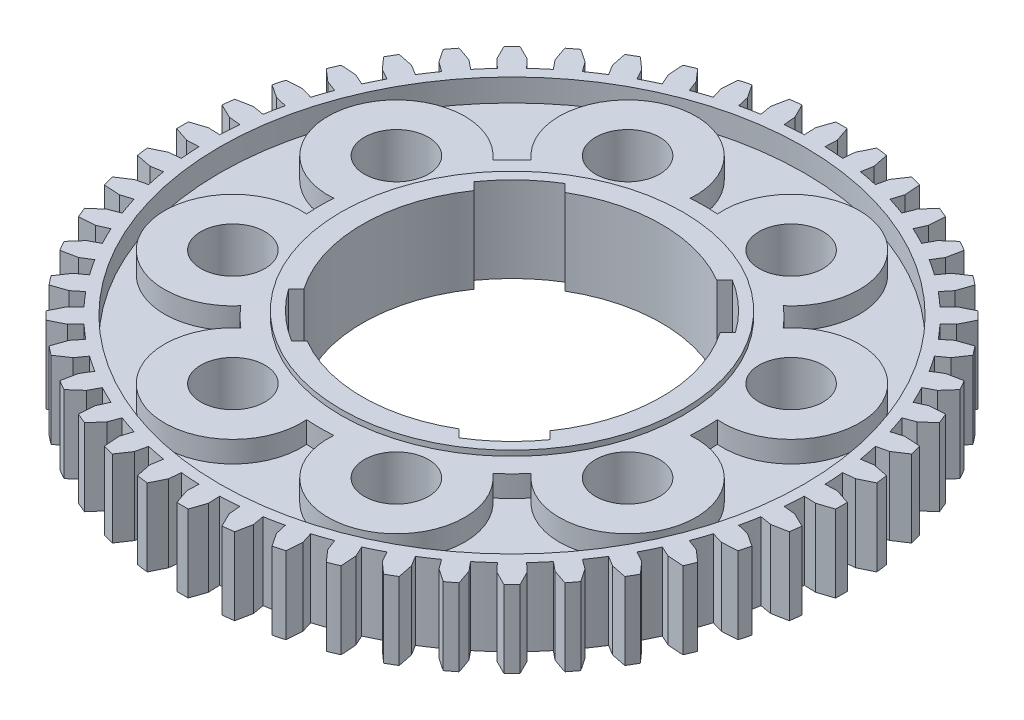
from build123d import *

# Parameters (mm, degrees)
BOSS_EXTRU_1_DEPTH      = 4
BOSS_EXTRU_1_DEPTH_BACK = 4
ESQUISSE2_R             = 16
BOSS_EXTRU_2_DEPTH      = 3.5
BOSS_EXTRU_2_DEPTH_BACK = 3.5
ESQUISSE2_6_R           = 3
ESQUISSE2_6_R_2         = 16
BOSS_EXTRU_3_DEPTH      = 1.5
BOSS_EXTRU_3_DEPTH_BACK = 1.5
ESQUISSE2_7_R           = 27.35
BOSS_EXTRU_4_DEPTH      = 3.61
BOSS_EXTRU_4_DEPTH_BACK = 3.61
ESQUISSE2_8_R           = 27.35


with BuildPart() as part:
    # Esquisse2 → Boss.-Extru.1 (new, two sides: drawn at the far end of the back side and taken through both)
    with BuildSketch(Plane(origin=(0, 0, 0), x_dir=(1, 0, 0), z_dir=(0, 1, 0)).offset(-BOSS_EXTRU_1_DEPTH_BACK)):
        Circle(ESQUISSE2_R)
        with BuildLine():
            ThreePointArc((-12.226017285, 8.690483379), (-10.241104329, 10.959917068), (-7.842441258, 12.786559941))
            Line((-7.842441258, 12.786559941), (-7.113811647, 12.05793033))
            ThreePointArc((-7.113811647, 12.05793033), (0, 14), (7.113811647, 12.05793033))
            Line((7.113811647, 12.05793033), (7.842441258, 12.786559941))
            ThreePointArc((7.842441258, 12.786559941), (10.241104329, 10.959917068), (12.226017285, 8.690483379))
            Line((12.226017285, 8.690483379), (11.508146822, 7.972612916))
            ThreePointArc((11.508146822, 7.972612916), (14, 0), (11.508146822, -7.972612916))
            Line((11.508146822, -7.972612916), (12.226017285, -8.690483379))
            ThreePointArc((12.226017285, -8.690483379), (10.241104329, -10.959917068), (7.842441258, -12.786559941))
            Line((7.842441258, -12.786559941), (7.113811647, -12.05793033))
            ThreePointArc((7.113811647, -12.05793033), (0, -14), (-7.113811647, -12.05793033))
            Line((-7.113811647, -12.05793033), (-7.842441258, -12.786559941))
            ThreePointArc((-7.842441258, -12.786559941), (-10.241104329, -10.959917068), (-12.226017285, -8.690483379))
            Line((-12.226017285, -8.690483379), (-11.508146822, -7.972612916))
            ThreePointArc((-11.508146822, -7.972612916), (-14, 0), (-11.508146822, 7.972612916))
            Line((-11.508146822, 7.972612916), (-12.226017285, 8.690483379))
        make_face(mode=Mode.SUBTRACT)
    extrude(amount=BOSS_EXTRU_1_DEPTH + BOSS_EXTRU_1_DEPTH_BACK)

    # Esquisse2<6> → Boss.-Extru.2 (add, two sides: drawn at the far end of the back side and taken through both)
    with BuildSketch(Plane(origin=(0, 0, 0), x_dir=(1, 0, 0), z_dir=(0, 1, 0)).offset(-BOSS_EXTRU_2_DEPTH_BACK)):
        with BuildLine():
            ThreePointArc((-13.597550957, 11.794346441), (-24.390419658, 10.102842614), (-17.954782837, 1.275058141))
            ThreePointArc((-17.954782837, 1.275058141), (-18, 0), (-17.954782837, -1.275058141))
            ThreePointArc((-17.954782837, -1.275058141), (-24.390419658, -10.102842614), (-13.597550957, -11.794346441))
            ThreePointArc((-13.597550957, -11.794346441), (-12.727922061, -12.727922061), (-11.794346441, -13.597550957))
            ThreePointArc((-11.794346441, -13.597550957), (-10.102842614, -24.390419658), (-1.275058141, -17.954782837))
            ThreePointArc((-1.275058141, -17.954782837), (0, -18), (1.275058141, -17.954782837))
            ThreePointArc((1.275058141, -17.954782837), (10.102842614, -24.390419658), (11.794346441, -13.597550957))
            ThreePointArc((11.794346441, -13.597550957), (12.727922061, -12.727922061), (13.597550957, -11.794346441))
            ThreePointArc((13.597550957, -11.794346441), (24.390419658, -10.102842614), (17.954782837, -1.275058141))
            ThreePointArc((17.954782837, -1.275058141), (18, 0), (17.954782837, 1.275058141))
            ThreePointArc((17.954782837, 1.275058141), (24.390419658, 10.102842614), (13.597550957, 11.794346441))
            ThreePointArc((13.597550957, 11.794346441), (12.727922061, 12.727922061), (11.794346441, 13.597550957))
            ThreePointArc((11.794346441, 13.597550957), (10.102842614, 24.390419658), (1.275058141, 17.954782837))
            ThreePointArc((1.275058141, 17.954782837), (0, 18), (-1.275058141, 17.954782837))
            ThreePointArc((-1.275058141, 17.954782837), (-10.102842614, 24.390419658), (-11.794346441, 13.597550957))
            ThreePointArc((-11.794346441, 13.597550957), (-12.727922061, 12.727922061), (-13.597550957, 11.794346441))
        make_face()
        with Locations((-7.653668647, -18.47759065)):
            Circle(ESQUISSE2_6_R, mode=Mode.SUBTRACT)
        with Locations((-18.47759065, -7.653668647)):
            Circle(ESQUISSE2_6_R, mode=Mode.SUBTRACT)
        with Locations((7.653668647, -18.47759065)):
            Circle(ESQUISSE2_6_R, mode=Mode.SUBTRACT)
        with Locations((18.47759065, -7.653668647)):
            Circle(ESQUISSE2_6_R, mode=Mode.SUBTRACT)
        with Locations((-18.47759065, 7.653668647)):
            Circle(ESQUISSE2_6_R, mode=Mode.SUBTRACT)
        with Locations((-7.653668647, 18.47759065)):
            Circle(ESQUISSE2_6_R, mode=Mode.SUBTRACT)
        Circle(ESQUISSE2_6_R_2, mode=Mode.SUBTRACT)
        with Locations((18.47759065, 7.653668647)):
            Circle(ESQUISSE2_6_R, mode=Mode.SUBTRACT)
        with Locations((7.653668647, 18.47759065)):
            Circle(ESQUISSE2_6_R, mode=Mode.SUBTRACT)
    extrude(amount=BOSS_EXTRU_2_DEPTH + BOSS_EXTRU_2_DEPTH_BACK)

    # Esquisse2<7> → Boss.-Extru.3 (add, two sides: drawn at the far end of the back side and taken through both)
    with BuildSketch(Plane(origin=(0, 0, 0), x_dir=(1, 0, 0), z_dir=(0, 1, 0)).offset(-BOSS_EXTRU_3_DEPTH_BACK)):
        Circle(ESQUISSE2_7_R)
        with BuildLine():
            ThreePointArc((-17.954782837, -1.275058141), (-18, 0), (-17.954782837, 1.275058141))
            ThreePointArc((-17.954782837, 1.275058141), (-24.390419658, 10.102842614), (-13.597550957, 11.794346441))
            ThreePointArc((-13.597550957, 11.794346441), (-12.727922061, 12.727922061), (-11.794346441, 13.597550957))
            ThreePointArc((-11.794346441, 13.597550957), (-10.102842614, 24.390419658), (-1.275058141, 17.954782837))
            ThreePointArc((-1.275058141, 17.954782837), (0, 18), (1.275058141, 17.954782837))
            ThreePointArc((1.275058141, 17.954782837), (10.102842614, 24.390419658), (11.794346441, 13.597550957))
            ThreePointArc((11.794346441, 13.597550957), (12.727922061, 12.727922061), (13.597550957, 11.794346441))
            ThreePointArc((13.597550957, 11.794346441), (24.390419658, 10.102842614), (17.954782837, 1.275058141))
            ThreePointArc((17.954782837, 1.275058141), (18, 0), (17.954782837, -1.275058141))
            ThreePointArc((17.954782837, -1.275058141), (24.390419658, -10.102842614), (13.597550957, -11.794346441))
            ThreePointArc((13.597550957, -11.794346441), (12.727922061, -12.727922061), (11.794346441, -13.597550957))
            ThreePointArc((11.794346441, -13.597550957), (10.102842614, -24.390419658), (1.275058141, -17.954782837))
            ThreePointArc((1.275058141, -17.954782837), (0, -18), (-1.275058141, -17.954782837))
            ThreePointArc((-1.275058141, -17.954782837), (-10.102842614, -24.390419658), (-11.794346441, -13.597550957))
            ThreePointArc((-11.794346441, -13.597550957), (-12.727922061, -12.727922061), (-13.597550957, -11.794346441))
            ThreePointArc((-13.597550957, -11.794346441), (-24.390419658, -10.102842614), (-17.954782837, -1.275058141))
        make_face(mode=Mode.SUBTRACT)
    extrude(amount=BOSS_EXTRU_3_DEPTH + BOSS_EXTRU_3_DEPTH_BACK)

    # Esquisse2<8> → Boss.-Extru.4 (add, two sides: drawn at the far end of the back side and taken through both)
    with BuildSketch(Plane(origin=(0, 0, 0), x_dir=(1, 0, 0), z_dir=(0, 1, 0)).offset(-BOSS_EXTRU_4_DEPTH_BACK)):
        with BuildLine():
            Line((-4.553787567, 30.511954315), (-4.847033615, 29.054834956))
            Line((-4.847033615, 29.054834956), (-4.658006431, 27.964718416))
            ThreePointArc((-4.658006431, 27.964718416), (-5.530810629, 27.805262699), (-6.398197624, 27.618572866))
            Line((-6.398197624, 27.618572866), (-6.640728818, 28.698046797))
            Line((-6.640728818, 28.698046797), (-7.469268277, 29.932029145))
            ThreePointArc((-7.469268277, 29.932029145), (-7.98454169, 29.798715263), (-8.497438497, 29.656531764))
            Line((-8.497438497, 29.656531764), (-8.597983543, 28.173601974))
            Line((-8.597983543, 28.173601974), (-8.268284752, 27.117484531))
            ThreePointArc((-8.268284752, 27.117484531), (-9.112808841, 26.845469171), (-9.948407308, 26.547159774))
            Line((-9.948407308, 26.547159774), (-10.341022477, 27.581306792))
            Line((-10.341022477, 27.581306792), (-11.312281441, 28.701021339))
            ThreePointArc((-11.312281441, 28.701021339), (-11.805745665, 28.501591299), (-12.295695899, 28.293677733))
            Line((-12.295695899, 28.293677733), (-12.190721948, 26.815136184))
            Line((-12.190721948, 26.815136184), (-11.737090428, 25.806262966))
            ThreePointArc((-11.737090428, 25.806262966), (-12.538884368, 25.426342222), (-13.328396983, 25.021517417))
            Line((-13.328396983, 25.021517417), (-13.852636548, 25.995570601))
            Line((-13.852636548, 25.995570601), (-14.961738333, 26.978931101))
            ThreePointArc((-14.961738333, 26.978931101), (-15.424950059, 26.716797207), (-15.883570534, 26.446711032))
            Line((-15.883570534, 26.446711032), (-15.586506252, 24.994520461))
            Line((-15.586506252, 24.994520461), (-15.005071233, 24.053489088))
            ThreePointArc((-15.005071233, 24.053489088), (-15.750416106, 23.572163509), (-16.480334092, 23.06774996))
            Line((-16.480334092, 23.06774996), (-17.127228167, 23.96504299))
            Line((-17.127228167, 23.96504299), (-18.355195734, 24.795223872))
            ThreePointArc((-18.355195734, 24.795223872), (-18.780229281, 24.474871306), (-19.199672874, 24.147233772))
            Line((-19.199672874, 24.147233772), (-18.715601113, 22.746241562))
            Line((-18.715601113, 22.746241562), (-18.016311108, 21.889153342))
            ThreePointArc((-18.016311108, 21.889153342), (-18.692453858, 21.314658542), (-19.350288114, 20.719286906))
            Line((-19.350288114, 20.719286906), (-20.108768164, 21.524466849))
            Line((-20.108768164, 21.524466849), (-21.434590647, 22.187263488))
            ThreePointArc((-21.434590647, 22.187263488), (-21.814173572, 21.814173572), (-22.187263488, 21.434590647))
            Line((-22.187263488, 21.434590647), (-21.524466849, 20.108768164))
            Line((-21.524466849, 20.108768164), (-20.719286906, 19.350288114))
            ThreePointArc((-20.719286906, 19.350288114), (-21.314658542, 18.692453858), (-21.889153342, 18.016311108))
            Line((-21.889153342, 18.016311108), (-22.746241562, 18.715601113))
            Line((-22.746241562, 18.715601113), (-24.147233772, 19.199672874))
            ThreePointArc((-24.147233772, 19.199672874), (-24.474871306, 18.780229281), (-24.795223872, 18.355195734))
            Line((-24.795223872, 18.355195734), (-23.96504299, 17.127228167))
            Line((-23.96504299, 17.127228167), (-23.06774996, 16.480334092))
            ThreePointArc((-23.06774996, 16.480334092), (-23.572163509, 15.750416106), (-24.053489088, 15.005071233))
            Line((-24.053489088, 15.005071233), (-24.994520461, 15.586506252))
            Line((-24.994520461, 15.586506252), (-26.446711032, 15.883570534))
            ThreePointArc((-26.446711032, 15.883570534), (-26.716797207, 15.424950059), (-26.978931101, 14.961738333))
            Line((-26.978931101, 14.961738333), (-25.995570601, 13.852636548))
            Line((-25.995570601, 13.852636548), (-25.021517417, 13.328396983))
            ThreePointArc((-25.021517417, 13.328396983), (-25.426342222, 12.538884368), (-25.806262966, 11.737090428))
            Line((-25.806262966, 11.737090428), (-26.815136184, 12.190721948))
            Line((-26.815136184, 12.190721948), (-28.293677733, 12.295695899))
            ThreePointArc((-28.293677733, 12.295695899), (-28.501591299, 11.805745665), (-28.701021339, 11.312281441))
            Line((-28.701021339, 11.312281441), (-27.581306792, 10.341022477))
            Line((-27.581306792, 10.341022477), (-26.547159774, 9.948407308))
            ThreePointArc((-26.547159774, 9.948407308), (-26.845469171, 9.112808841), (-27.117484531, 8.268284752))
            Line((-27.117484531, 8.268284752), (-28.176937493, 8.586351012))
            Line((-28.176937493, 8.586351012), (-29.656531764, 8.497438497))
            ThreePointArc((-29.656531764, 8.497438497), (-29.798715263, 7.98454169), (-29.932029145, 7.469268277))
            Line((-29.932029145, 7.469268277), (-28.695119176, 6.652470644))
            Line((-28.695119176, 6.652470644), (-27.618572866, 6.398197624))
            ThreePointArc((-27.618572866, 6.398197624), (-27.805262699, 5.530810629), (-27.964718416, 4.658006431))
            Line((-27.964718416, 4.658006431), (-29.05662359, 4.835065229))
            Line((-29.05662359, 4.835065229), (-30.511954315, 4.553787567))
            ThreePointArc((-30.511954315, 4.553787567), (-30.585974946, 4.026719993), (-30.650891633, 3.498453861))
            Line((-30.650891633, 3.498453861), (-29.317950116, 2.850093194))
            Line((-29.317950116, 2.850093194), (-28.21742452, 2.738513006))
            ThreePointArc((-28.21742452, 2.738513006), (-28.289300474, 1.854178714), (-28.333468216, 0.968028329))
            Line((-28.333468216, 0.968028329), (-29.438931657, 1.013149598))
            Line((-29.438931657, 1.013149598), (-30.845097723, 0.544319527))
            ThreePointArc((-30.845097723, 0.544319527), (-30.849900118, 0), (-30.845097723, -0.544319527))
            Line((-30.845097723, -0.544319527), (-29.438931657, -1.013149598))
            Line((-29.438931657, -1.013149598), (-28.333468216, -0.968028329))
            ThreePointArc((-28.333468216, -0.968028329), (-28.289300474, -1.854178714), (-28.21742452, -2.738513006))
            Line((-28.21742452, -2.738513006), (-29.317950116, -2.850093194))
            Line((-29.317950116, -2.850093194), (-30.650891633, -3.498453861))
            ThreePointArc((-30.650891633, -3.498453861), (-30.585974946, -4.026719993), (-30.511954315, -4.553787567))
            Line((-30.511954315, -4.553787567), (-29.05662359, -4.835065229))
            Line((-29.05662359, -4.835065229), (-27.964718416, -4.658006431))
            ThreePointArc((-27.964718416, -4.658006431), (-27.805262699, -5.530810629), (-27.618572866, -6.398197624))
            Line((-27.618572866, -6.398197624), (-28.695119176, -6.652470644))
            Line((-28.695119176, -6.652470644), (-29.932029145, -7.469268277))
            ThreePointArc((-29.932029145, -7.469268277), (-29.798715263, -7.98454169), (-29.656531764, -8.497438497))
            Line((-29.656531764, -8.497438497), (-28.176937493, -8.586351012))
            Line((-28.176937493, -8.586351012), (-27.117484531, -8.268284752))
            ThreePointArc((-27.117484531, -8.268284752), (-26.845469171, -9.112808841), (-26.547159774, -9.948407308))
            Line((-26.547159774, -9.948407308), (-27.581306792, -10.341022477))
            Line((-27.581306792, -10.341022477), (-28.701021339, -11.312281441))
            ThreePointArc((-28.701021339, -11.312281441), (-28.501591299, -11.805745665), (-28.293677733, -12.295695899))
            Line((-28.293677733, -12.295695899), (-26.815136184, -12.190721948))
            Line((-26.815136184, -12.190721948), (-25.806262966, -11.737090428))
            ThreePointArc((-25.806262966, -11.737090428), (-25.426342222, -12.538884368), (-25.021517417, -13.328396983))
            Line((-25.021517417, -13.328396983), (-25.995570601, -13.852636548))
            Line((-25.995570601, -13.852636548), (-26.978931101, -14.961738333))
            ThreePointArc((-26.978931101, -14.961738333), (-26.716797207, -15.424950059), (-26.446711032, -15.883570534))
            Line((-26.446711032, -15.883570534), (-24.994520461, -15.586506252))
            Line((-24.994520461, -15.586506252), (-24.053489088, -15.005071233))
            ThreePointArc((-24.053489088, -15.005071233), (-23.572163509, -15.750416106), (-23.06774996, -16.480334092))
            Line((-23.06774996, -16.480334092), (-23.96504299, -17.127228167))
            Line((-23.96504299, -17.127228167), (-24.795223872, -18.355195734))
            ThreePointArc((-24.795223872, -18.355195734), (-24.474871306, -18.780229281), (-24.147233772, -19.199672874))
            Line((-24.147233772, -19.199672874), (-22.746241562, -18.715601113))
            Line((-22.746241562, -18.715601113), (-21.889153342, -18.016311108))
            ThreePointArc((-21.889153342, -18.016311108), (-21.314658542, -18.692453858), (-20.719286906, -19.350288114))
            Line((-20.719286906, -19.350288114), (-21.524466849, -20.108768164))
            Line((-21.524466849, -20.108768164), (-22.187263488, -21.434590647))
            ThreePointArc((-22.187263488, -21.434590647), (-21.814173572, -21.814173572), (-21.434590647, -22.187263488))
            Line((-21.434590647, -22.187263488), (-20.108768164, -21.524466849))
            Line((-20.108768164, -21.524466849), (-19.350288114, -20.719286906))
            ThreePointArc((-19.350288114, -20.719286906), (-18.692453858, -21.314658542), (-18.016311108, -21.889153342))
            Line((-18.016311108, -21.889153342), (-18.715601113, -22.746241562))
            Line((-18.715601113, -22.746241562), (-19.199672874, -24.147233772))
            ThreePointArc((-19.199672874, -24.147233772), (-18.780229281, -24.474871306), (-18.355195734, -24.795223872))
            Line((-18.355195734, -24.795223872), (-17.127228167, -23.96504299))
            Line((-17.127228167, -23.96504299), (-16.480334092, -23.06774996))
            ThreePointArc((-16.480334092, -23.06774996), (-15.750416106, -23.572163509), (-15.005071233, -24.053489088))
            Line((-15.005071233, -24.053489088), (-15.586506252, -24.994520461))
            Line((-15.586506252, -24.994520461), (-15.883570534, -26.446711032))
            ThreePointArc((-15.883570534, -26.446711032), (-15.424950059, -26.716797207), (-14.961738333, -26.978931101))
            Line((-14.961738333, -26.978931101), (-13.852636548, -25.995570601))
            Line((-13.852636548, -25.995570601), (-13.328396983, -25.021517417))
            ThreePointArc((-13.328396983, -25.021517417), (-12.538884368, -25.426342222), (-11.737090428, -25.806262966))
            Line((-11.737090428, -25.806262966), (-12.190721948, -26.815136184))
            Line((-12.190721948, -26.815136184), (-12.295695899, -28.293677733))
            ThreePointArc((-12.295695899, -28.293677733), (-11.805745665, -28.501591299), (-11.312281441, -28.701021339))
            Line((-11.312281441, -28.701021339), (-10.341022477, -27.581306792))
            Line((-10.341022477, -27.581306792), (-9.948407308, -26.547159774))
            ThreePointArc((-9.948407308, -26.547159774), (-9.112808841, -26.845469171), (-8.268284752, -27.117484531))
            Line((-8.268284752, -27.117484531), (-8.597983543, -28.173601974))
            Line((-8.597983543, -28.173601974), (-8.497438497, -29.656531764))
            ThreePointArc((-8.497438497, -29.656531764), (-7.98454169, -29.798715263), (-7.469268277, -29.932029145))
            Line((-7.469268277, -29.932029145), (-6.640728818, -28.698046797))
            Line((-6.640728818, -28.698046797), (-6.398197624, -27.618572866))
            ThreePointArc((-6.398197624, -27.618572866), (-5.530810629, -27.805262699), (-4.658006431, -27.964718416))
            Line((-4.658006431, -27.964718416), (-4.847033615, -29.054834956))
            Line((-4.847033615, -29.054834956), (-4.553787567, -30.511954315))
            ThreePointArc((-4.553787567, -30.511954315), (-4.026719993, -30.585974946), (-3.498453861, -30.650891633))
            Line((-3.498453861, -30.650891633), (-2.83806969, -29.319320075))
            Line((-2.83806969, -29.319320075), (-2.738513006, -28.21742452))
            ThreePointArc((-2.738513006, -28.21742452), (-1.854178714, -28.289300474), (-0.968028329, -28.333468216))
            Line((-0.968028329, -28.333468216), (-1.013149598, -29.438931657))
            Line((-1.013149598, -29.438931657), (-0.532220069, -30.845308867))
            ThreePointArc((-0.532220069, -30.845308867), (0, -30.849900118), (0.532220069, -30.845308867))
            Line((0.532220069, -30.845308867), (1.013149598, -29.438931657))
            Line((1.013149598, -29.438931657), (0.968028329, -28.333468216))
            ThreePointArc((0.968028329, -28.333468216), (1.854178714, -28.289300474), (2.738513006, -28.21742452))
            Line((2.738513006, -28.21742452), (2.83806969, -29.319320075))
            Line((2.83806969, -29.319320075), (3.498453861, -30.650891633))
            ThreePointArc((3.498453861, -30.650891633), (4.026719993, -30.585974946), (4.553787567, -30.511954315))
            Line((4.553787567, -30.511954315), (4.847033615, -29.054834956))
            Line((4.847033615, -29.054834956), (4.658006431, -27.964718416))
            ThreePointArc((4.658006431, -27.964718416), (5.530810629, -27.805262699), (6.398197624, -27.618572866))
            Line((6.398197624, -27.618572866), (6.640728818, -28.698046797))
            Line((6.640728818, -28.698046797), (7.469268277, -29.932029145))
            ThreePointArc((7.469268277, -29.932029145), (7.98454169, -29.798715263), (8.497438497, -29.656531764))
            Line((8.497438497, -29.656531764), (8.597983543, -28.173601974))
            Line((8.597983543, -28.173601974), (8.268284752, -27.117484531))
            ThreePointArc((8.268284752, -27.117484531), (9.112808841, -26.845469171), (9.948407308, -26.547159774))
            Line((9.948407308, -26.547159774), (10.341022477, -27.581306792))
            Line((10.341022477, -27.581306792), (11.312281441, -28.701021339))
            ThreePointArc((11.312281441, -28.701021339), (11.805745665, -28.501591299), (12.295695899, -28.293677733))
            Line((12.295695899, -28.293677733), (12.190721948, -26.815136184))
            Line((12.190721948, -26.815136184), (11.737090428, -25.806262966))
            ThreePointArc((11.737090428, -25.806262966), (12.538884368, -25.426342222), (13.328396983, -25.021517417))
            Line((13.328396983, -25.021517417), (13.852636548, -25.995570601))
            Line((13.852636548, -25.995570601), (14.961738333, -26.978931101))
            ThreePointArc((14.961738333, -26.978931101), (15.424950059, -26.716797207), (15.883570534, -26.446711032))
            Line((15.883570534, -26.446711032), (15.586506252, -24.994520461))
            Line((15.586506252, -24.994520461), (15.005071233, -24.053489088))
            ThreePointArc((15.005071233, -24.053489088), (15.750416106, -23.572163509), (16.480334092, -23.06774996))
            Line((16.480334092, -23.06774996), (17.127228167, -23.96504299))
            Line((17.127228167, -23.96504299), (18.355195734, -24.795223872))
            ThreePointArc((18.355195734, -24.795223872), (18.780229281, -24.474871306), (19.199672874, -24.147233772))
            Line((19.199672874, -24.147233772), (18.715601113, -22.746241562))
            Line((18.715601113, -22.746241562), (18.016311108, -21.889153342))
            ThreePointArc((18.016311108, -21.889153342), (18.692453858, -21.314658542), (19.350288114, -20.719286906))
            Line((19.350288114, -20.719286906), (20.108768164, -21.524466849))
            Line((20.108768164, -21.524466849), (21.434590647, -22.187263488))
            ThreePointArc((21.434590647, -22.187263488), (21.814173572, -21.814173572), (22.187263488, -21.434590647))
            Line((22.187263488, -21.434590647), (21.524466849, -20.108768164))
            Line((21.524466849, -20.108768164), (20.719286906, -19.350288114))
            ThreePointArc((20.719286906, -19.350288114), (21.314658542, -18.692453858), (21.889153342, -18.016311108))
            Line((21.889153342, -18.016311108), (22.746241562, -18.715601113))
            Line((22.746241562, -18.715601113), (24.147233772, -19.199672874))
            ThreePointArc((24.147233772, -19.199672874), (24.474871306, -18.780229281), (24.795223872, -18.355195734))
            Line((24.795223872, -18.355195734), (23.96504299, -17.127228167))
            Line((23.96504299, -17.127228167), (23.06774996, -16.480334092))
            ThreePointArc((23.06774996, -16.480334092), (23.572163509, -15.750416106), (24.053489088, -15.005071233))
            Line((24.053489088, -15.005071233), (24.994520461, -15.586506252))
            Line((24.994520461, -15.586506252), (26.446711032, -15.883570534))
            ThreePointArc((26.446711032, -15.883570534), (26.716797207, -15.424950059), (26.978931101, -14.961738333))
            Line((26.978931101, -14.961738333), (25.995570601, -13.852636548))
            Line((25.995570601, -13.852636548), (25.021517417, -13.328396983))
            ThreePointArc((25.021517417, -13.328396983), (25.426342222, -12.538884368), (25.806262966, -11.737090428))
            Line((25.806262966, -11.737090428), (26.815136184, -12.190721948))
            Line((26.815136184, -12.190721948), (28.293677733, -12.295695899))
            ThreePointArc((28.293677733, -12.295695899), (28.501591299, -11.805745665), (28.701021339, -11.312281441))
            Line((28.701021339, -11.312281441), (27.581306792, -10.341022477))
            Line((27.581306792, -10.341022477), (26.547159774, -9.948407308))
            ThreePointArc((26.547159774, -9.948407308), (26.845469171, -9.112808841), (27.117484531, -8.268284752))
            Line((27.117484531, -8.268284752), (28.176937493, -8.586351012))
            Line((28.176937493, -8.586351012), (29.656531764, -8.497438497))
            ThreePointArc((29.656531764, -8.497438497), (29.798715263, -7.98454169), (29.932029145, -7.469268277))
            Line((29.932029145, -7.469268277), (28.695119176, -6.652470644))
            Line((28.695119176, -6.652470644), (27.618572866, -6.398197624))
            ThreePointArc((27.618572866, -6.398197624), (27.805262699, -5.530810629), (27.964718416, -4.658006431))
            Line((27.964718416, -4.658006431), (29.05662359, -4.835065229))
            Line((29.05662359, -4.835065229), (30.511954315, -4.553787567))
            ThreePointArc((30.511954315, -4.553787567), (30.585974946, -4.026719993), (30.650891633, -3.498453861))
            Line((30.650891633, -3.498453861), (29.317950116, -2.850093194))
            Line((29.317950116, -2.850093194), (28.21742452, -2.738513006))
            ThreePointArc((28.21742452, -2.738513006), (28.289300474, -1.854178714), (28.333468216, -0.968028329))
            Line((28.333468216, -0.968028329), (29.438931657, -1.013149598))
            Line((29.438931657, -1.013149598), (30.845097723, -0.544319527))
            ThreePointArc((30.845097723, -0.544319527), (30.849900118, 0), (30.845097723, 0.544319527))
            Line((30.845097723, 0.544319527), (29.438931657, 1.013149598))
            Line((29.438931657, 1.013149598), (28.333468216, 0.968028329))
            ThreePointArc((28.333468216, 0.968028329), (28.289300474, 1.854178714), (28.21742452, 2.738513006))
            Line((28.21742452, 2.738513006), (29.317950116, 2.850093194))
            Line((29.317950116, 2.850093194), (30.650891633, 3.498453861))
            ThreePointArc((30.650891633, 3.498453861), (30.585974946, 4.026719993), (30.511954315, 4.553787567))
            Line((30.511954315, 4.553787567), (29.05662359, 4.835065229))
            Line((29.05662359, 4.835065229), (27.964718416, 4.658006431))
            ThreePointArc((27.964718416, 4.658006431), (27.805262699, 5.530810629), (27.618572866, 6.398197624))
            Line((27.618572866, 6.398197624), (28.695119176, 6.652470644))
            Line((28.695119176, 6.652470644), (29.932029145, 7.469268277))
            ThreePointArc((29.932029145, 7.469268277), (29.798715263, 7.98454169), (29.656531764, 8.497438497))
            Line((29.656531764, 8.497438497), (28.176937493, 8.586351012))
            Line((28.176937493, 8.586351012), (27.117484531, 8.268284752))
            ThreePointArc((27.117484531, 8.268284752), (26.845469171, 9.112808841), (26.547159774, 9.948407308))
            Line((26.547159774, 9.948407308), (27.581306792, 10.341022477))
            Line((27.581306792, 10.341022477), (28.701021339, 11.312281441))
            ThreePointArc((28.701021339, 11.312281441), (28.501591299, 11.805745665), (28.293677733, 12.295695899))
            Line((28.293677733, 12.295695899), (26.815136184, 12.190721948))
            Line((26.815136184, 12.190721948), (25.806262966, 11.737090428))
            ThreePointArc((25.806262966, 11.737090428), (25.426342222, 12.538884368), (25.021517417, 13.328396983))
            Line((25.021517417, 13.328396983), (25.995570601, 13.852636548))
            Line((25.995570601, 13.852636548), (26.978931101, 14.961738333))
            ThreePointArc((26.978931101, 14.961738333), (26.716797207, 15.424950059), (26.446711032, 15.883570534))
            Line((26.446711032, 15.883570534), (24.994520461, 15.586506252))
            Line((24.994520461, 15.586506252), (24.053489088, 15.005071233))
            ThreePointArc((24.053489088, 15.005071233), (23.572163509, 15.750416106), (23.06774996, 16.480334092))
            Line((23.06774996, 16.480334092), (23.96504299, 17.127228167))
            Line((23.96504299, 17.127228167), (24.795223872, 18.355195734))
            ThreePointArc((24.795223872, 18.355195734), (24.474871306, 18.780229281), (24.147233772, 19.199672874))
            Line((24.147233772, 19.199672874), (22.746241562, 18.715601113))
            Line((22.746241562, 18.715601113), (21.889153342, 18.016311108))
            ThreePointArc((21.889153342, 18.016311108), (21.314658542, 18.692453858), (20.719286906, 19.350288114))
            Line((20.719286906, 19.350288114), (21.524466849, 20.108768164))
            Line((21.524466849, 20.108768164), (22.187263488, 21.434590647))
            ThreePointArc((22.187263488, 21.434590647), (21.814173572, 21.814173572), (21.434590647, 22.187263488))
            Line((21.434590647, 22.187263488), (20.108768164, 21.524466849))
            Line((20.108768164, 21.524466849), (19.350288114, 20.719286906))
            ThreePointArc((19.350288114, 20.719286906), (18.692453858, 21.314658542), (18.016311108, 21.889153342))
            Line((18.016311108, 21.889153342), (18.715601113, 22.746241562))
            Line((18.715601113, 22.746241562), (19.199672874, 24.147233772))
            ThreePointArc((19.199672874, 24.147233772), (18.780229281, 24.474871306), (18.355195734, 24.795223872))
            Line((18.355195734, 24.795223872), (17.127228167, 23.96504299))
            Line((17.127228167, 23.96504299), (16.480334092, 23.06774996))
            ThreePointArc((16.480334092, 23.06774996), (15.750416106, 23.572163509), (15.005071233, 24.053489088))
            Line((15.005071233, 24.053489088), (15.586506252, 24.994520461))
            Line((15.586506252, 24.994520461), (15.883570534, 26.446711032))
            ThreePointArc((15.883570534, 26.446711032), (15.424950059, 26.716797207), (14.961738333, 26.978931101))
            Line((14.961738333, 26.978931101), (13.852636548, 25.995570601))
            Line((13.852636548, 25.995570601), (13.328396983, 25.021517417))
            ThreePointArc((13.328396983, 25.021517417), (12.538884368, 25.426342222), (11.737090428, 25.806262966))
            Line((11.737090428, 25.806262966), (12.190721948, 26.815136184))
            Line((12.190721948, 26.815136184), (12.295695899, 28.293677733))
            ThreePointArc((12.295695899, 28.293677733), (11.805745665, 28.501591299), (11.312281441, 28.701021339))
            Line((11.312281441, 28.701021339), (10.341022477, 27.581306792))
            Line((10.341022477, 27.581306792), (9.948407308, 26.547159774))
            ThreePointArc((9.948407308, 26.547159774), (9.112808841, 26.845469171), (8.268284752, 27.117484531))
            Line((8.268284752, 27.117484531), (8.597983543, 28.173601974))
            Line((8.597983543, 28.173601974), (8.497438497, 29.656531764))
            ThreePointArc((8.497438497, 29.656531764), (7.98454169, 29.798715263), (7.469268277, 29.932029145))
            Line((7.469268277, 29.932029145), (6.640728818, 28.698046797))
            Line((6.640728818, 28.698046797), (6.398197624, 27.618572866))
            ThreePointArc((6.398197624, 27.618572866), (5.530810629, 27.805262699), (4.658006431, 27.964718416))
            Line((4.658006431, 27.964718416), (4.847033615, 29.054834956))
            Line((4.847033615, 29.054834956), (4.553787567, 30.511954315))
            ThreePointArc((4.553787567, 30.511954315), (4.026719993, 30.585974946), (3.498453861, 30.650891633))
            Line((3.498453861, 30.650891633), (2.83806969, 29.319320075))
            Line((2.83806969, 29.319320075), (2.738513006, 28.21742452))
            ThreePointArc((2.738513006, 28.21742452), (1.854178714, 28.289300474), (0.968028329, 28.333468216))
            Line((0.968028329, 28.333468216), (1.013149598, 29.438931657))
            Line((1.013149598, 29.438931657), (0.532220069, 30.845308867))
            ThreePointArc((0.532220069, 30.845308867), (0, 30.849900118), (-0.532220069, 30.845308867))
            Line((-0.532220069, 30.845308867), (-1.013149598, 29.438931657))
            Line((-1.013149598, 29.438931657), (-0.968028329, 28.333468216))
            ThreePointArc((-0.968028329, 28.333468216), (-1.854178714, 28.289300474), (-2.738513006, 28.21742452))
            Line((-2.738513006, 28.21742452), (-2.83806969, 29.319320075))
            Line((-2.83806969, 29.319320075), (-3.498453861, 30.650891633))
            ThreePointArc((-3.498453861, 30.650891633), (-4.026719993, 30.585974946), (-4.553787567, 30.511954315))
        make_face()
        Circle(ESQUISSE2_8_R, mode=Mode.SUBTRACT)
    extrude(amount=BOSS_EXTRU_4_DEPTH + BOSS_EXTRU_4_DEPTH_BACK)


solid = part.part
